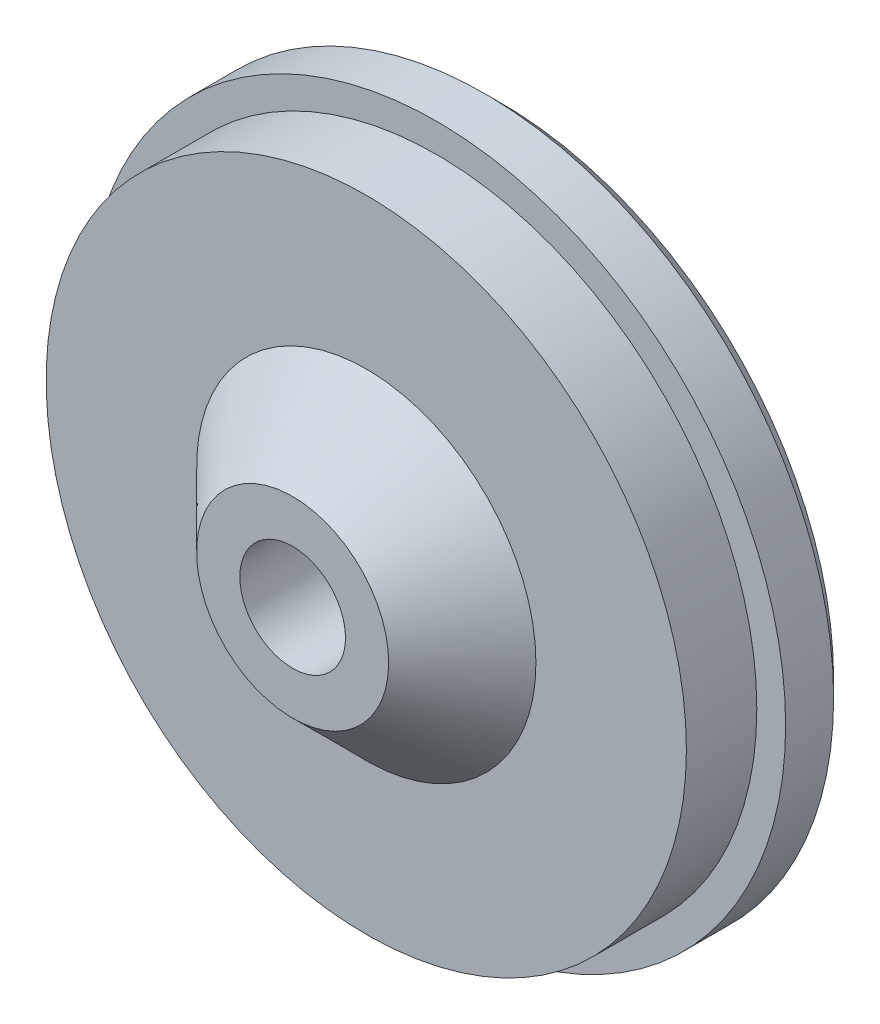
from build123d import *

# Parameters (mm, degrees)
SKETCH1_R           = 10.9
BOSS_EXTRUDE1_DEPTH = 2
SKETCH2_R           = 10
BOSS_EXTRUDE2_DEPTH = 2.2
SKETCH4_R           = 3
BOSS_EXTRUDE3_DEPTH = 2.3
SKETCH3_R           = 1.65
CUT_EXTRUDE1_DEPTH  = 17.729315587
CHAMFER1_SIZE       = 2.3
CHAMFER2_SIZE       = 0.5
CHAMFER3_SIZE       = 0.5


with BuildPart() as part:
    # Sketch1 → Boss-Extrude1 (new body)
    with BuildSketch(Plane.XY):
        Circle(SKETCH1_R)
    extrude(amount=BOSS_EXTRUDE1_DEPTH)

    # Sketch2 → Boss-Extrude2 (add)
    with BuildSketch(Plane.XY.offset(2)):
        Circle(SKETCH2_R)
    extrude(amount=BOSS_EXTRUDE2_DEPTH)

    # Sketch4 → Boss-Extrude3 (add)
    with BuildSketch(Plane.XY.offset(4.2)):
        Circle(SKETCH4_R)
    extrude(amount=BOSS_EXTRUDE3_DEPTH)

    # Sketch3 → Cut-Extrude1 (cut, through all)
    with BuildSketch(Plane(origin=(0, 0, 0), x_dir=(-1, 0, 0), z_dir=(0, 0, -1))):
        Circle(SKETCH3_R)
    extrude(amount=-CUT_EXTRUDE1_DEPTH, mode=Mode.SUBTRACT)

    # Chamfer1
    chamfer1_edges = [part.edges().sort_by_distance(p)[0] for p in [
        (-3, 0, 4.2),
    ]]
    chamfer(chamfer1_edges, length=CHAMFER1_SIZE - 0.0001)  # a hair under: the kernel refuses the full size

    # Chamfer2
    chamfer2_edges = [part.edges().sort_by_distance(p)[0] for p in [
        (1.65, 0, 0),
    ]]
    chamfer(chamfer2_edges, length=CHAMFER2_SIZE)

    # Chamfer3
    chamfer3_edges = [part.edges().sort_by_distance(p)[0] for p in [
        (-10.9, 0, 0),
    ]]
    chamfer(chamfer3_edges, length=CHAMFER3_SIZE)


solid = part.part
